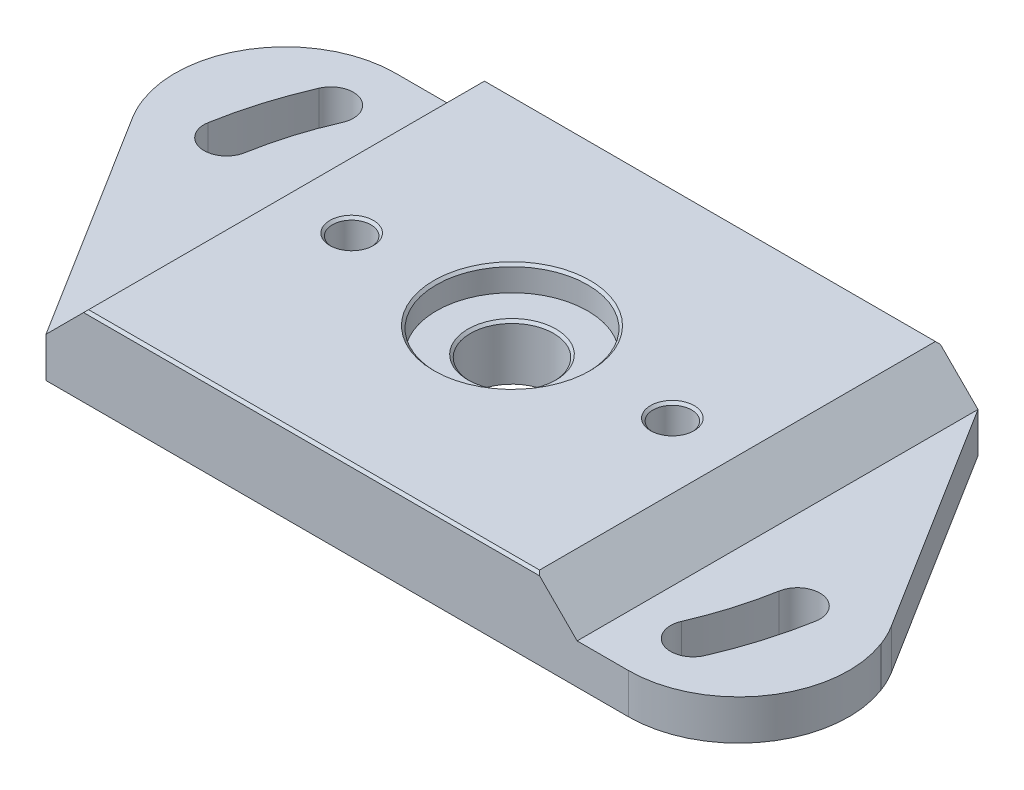
from build123d import *

# Parameters (mm, degrees)
BASE_DEPTH                 = 4
SKETCH2_W                  = 45
SKETCH2_H                  = 40
TPS_STANDOFF_DEPTH         = 4
SKETCH4_R                  = 1.925
TPS_SCREW_HOLES_DEPTH      = 8
MOUNTING_SCREW_HOLES_DEPTH = 4
SKETCH7_R                  = 10
SKETCH7_R_2                = 7.5
O_RING_CUT_DEPTH           = 2.5
CHAMFER1_SIZE              = 4
CHAMFER3_SIZE              = 0.25
CUT_EXTRUDE3_DEPTH         = 90.532117142
CUT_EXTRUDE3_DEPTH_BACK    = 90.532117142
FILLET4_R                  = 11


with BuildPart() as part:
    # Sketch1 → Base (new body)
    with BuildSketch(Plane(origin=(0, 0, 0), x_dir=(1, 0, 0), z_dir=(0, 1, 0))):
        Polygon((-5, 40), (65, 40), (80, 0), (60, 0), (0, 0), (-15, 40), align=None)
    extrude(amount=BASE_DEPTH)

    # Sketch2 → TPS Standoff (add)
    with BuildSketch(Plane(origin=(0, 4, 0), x_dir=(1, 0, 0), z_dir=(0, 1, 0))):
        with Locations((32.5, 20)):
            Rectangle(SKETCH2_W, SKETCH2_H)
    extrude(amount=TPS_STANDOFF_DEPTH)

    # Sketch4 → TPS Screw Holes (cut)
    with BuildSketch(Plane(origin=(0, 8, 0), x_dir=(1, 0, 0), z_dir=(0, 1, 0))):
        with Locations(Location((48.5, 20, 0), (0, 0, 270))):
            Circle(SKETCH4_R)
        with Locations(Location((16.5, 20, 0), (0, 0, 270))):
            Circle(SKETCH4_R)
    extrude(amount=-TPS_SCREW_HOLES_DEPTH, mode=Mode.SUBTRACT)

    # Sketch5 → Mounting Screw Holes (cut)
    with BuildSketch(Plane(origin=(0, 4, 0), x_dir=(1, 0, 0), z_dir=(0, 1, 0))):
        with BuildLine():
            ThreePointArc((-1.640188927, 34.9), (-3.174301135, 30.719456076), (-4.19857154, 26.385714286))
            ThreePointArc((-4.19857154, 26.385714286), (-2.367593585, 23.783307759), (0.234812942, 25.614285714))
            ThreePointArc((0.234812942, 25.614285714), (1.135345982, 29.424488228), (2.484129198, 33.1))
            ThreePointArc((2.484129198, 33.1), (1.321970135, 36.062159063), (-1.640188927, 34.9))
        make_face()
        with BuildLine():
            ThreePointArc((66.640188927, 5.1), (68.174301135, 9.280543924), (69.19857154, 13.614285714))
            ThreePointArc((69.19857154, 13.614285714), (67.367593585, 16.216692241), (64.765187058, 14.385714286))
            ThreePointArc((64.765187058, 14.385714286), (63.864654018, 10.575511772), (62.515870802, 6.9))
            ThreePointArc((62.515870802, 6.9), (63.678029865, 3.937840937), (66.640188927, 5.1))
        make_face()
    extrude(amount=-MOUNTING_SCREW_HOLES_DEPTH, mode=Mode.SUBTRACT)

    # Sketch6 → TPS Shaft Bore Cut (revolve, cut)
    with BuildSketch(Plane.YZ.offset(32.5)):
        Polygon((8, -20), (0, -20), (0, -24.15), (5.5, -24.15), (5.5, -27.55), (8, -27.55), align=None)
    revolve(axis=Axis((32.5, 8, -20), (0, 1, 0)), mode=Mode.SUBTRACT)

    # Sketch7 → O-Ring Cut (cut)
    with BuildSketch(Plane.XZ):
        with Locations(Location((32.5, -20, 0), (0, 0, 270))):
            Circle(SKETCH7_R)
        with Locations(Location((32.5, -20, 0), (0, 0, 270))):
            Circle(SKETCH7_R_2, mode=Mode.SUBTRACT)
    extrude(amount=-O_RING_CUT_DEPTH, mode=Mode.SUBTRACT)

    # Chamfer1
    chamfer1_edges = [part.edges().sort_by_distance(p)[0] for p in [
        (55, 4, -20),
        (10, 4, -20),
    ]]
    chamfer(chamfer1_edges, length=CHAMFER1_SIZE - 0.0001)  # a hair under: the kernel refuses the full size

    # Chamfer3
    chamfer3_edges = [part.edges().sort_by_distance(p)[0] for p in [
        (32.5, 8, 0),
        (32.5, 8, -40),
        (48.5, 8, -21.925),
        (16.5, 8, -21.925),
        (32.5, 8, -12.45),
        (32.5, 5.5, -15.85),
    ]]
    chamfer(chamfer3_edges, length=CHAMFER3_SIZE)

    # Sketch9 → Cut-Extrude3 (cut, two sides: drawn at the far end of the back side and taken through both)
    with BuildSketch(Plane(origin=(0, 4, 0), x_dir=(1, 0, 0), z_dir=(0, 1, 0)).offset(-CUT_EXTRUDE3_DEPTH_BACK)):
        Polygon((6, 0), (-9, 24), (0, 0), align=None)
        Polygon((59, 40), (65, 40), (74, 16), align=None)
    extrude(amount=CUT_EXTRUDE3_DEPTH + CUT_EXTRUDE3_DEPTH_BACK, mode=Mode.SUBTRACT)

    # Fillet4
    fillet4_edges = [part.edges().sort_by_distance(p)[0] for p in [
        (-15, 2, -40),
        (80, 2, 0),
        (-9, 2, -24),
        (74, 2, -16),
    ]]
    fillet(fillet4_edges, radius=FILLET4_R)


solid = part.part
